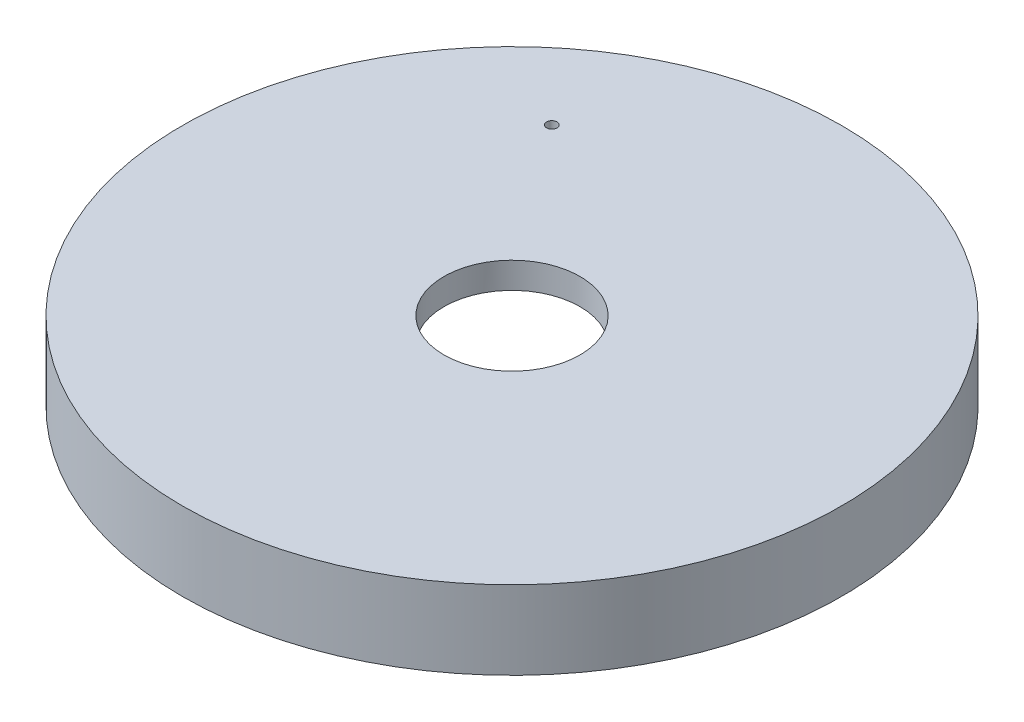
from build123d import *

# Parameters (mm, degrees)
SZKIC2_R                   = 1
WYTNIJ_WYCI_GNI_CIE2_DEPTH = 15


with BuildPart() as part:
    # Szkic1 → Obrót1 (revolve)
    with BuildSketch(Plane.XY):
        Polygon((13, 2.5), (63, 2.5), (63, -12.5), (40.474774195, -12.5), (13, -2.5), align=None)
    revolve(axis=Axis((0, 24.608336301, 0), (0, -1, 0)))

    # Szkic2 → Wytnij-wyciągnięcie2 (cut, symmetric)
    with BuildSketch(Plane(origin=(0, 0, 0), x_dir=(1, 0, 0), z_dir=(0, 1, 0))):
        with Locations((-27.785960816, 35.396897909)):
            Circle(SZKIC2_R)
    extrude(amount=WYTNIJ_WYCI_GNI_CIE2_DEPTH, both=True, mode=Mode.SUBTRACT)


solid = part.part
